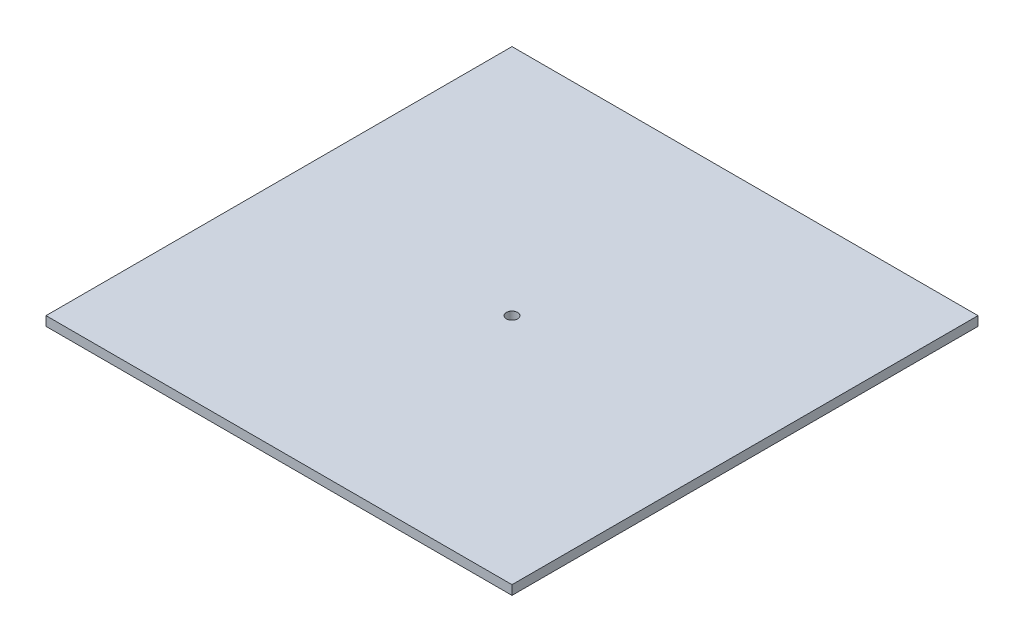
from build123d import *

# Parameters (mm, degrees)
ESQUISSE1_W                 = 500
ESQUISSE1_H                 = 500
BOSS_EXTRU_1_DEPTH          = 5
D_GAGEMENT_M101_D           = 12
D_GAGEMENT_M101_CSINK_D     = 12.05
D_GAGEMENT_M101_CSINK_ANGLE = 90


with BuildPart() as part:
    # Esquisse1 → Boss.-Extru.1 (new, symmetric)
    with BuildSketch(Plane(origin=(0, 0, 0), x_dir=(1, 0, 0), z_dir=(0, 1, 0))):
        Rectangle(ESQUISSE1_W, ESQUISSE1_H)
    extrude(amount=BOSS_EXTRU_1_DEPTH, both=True)

    # Dégagement M101 (through all)
    with Locations(Plane(origin=(0, 5, 0), x_dir=(1, 0, 0), z_dir=(0, 1, 0))):
        with Locations((0, 0)):
            CounterSinkHole(D_GAGEMENT_M101_D / 2, D_GAGEMENT_M101_CSINK_D / 2, counter_sink_angle=D_GAGEMENT_M101_CSINK_ANGLE)


solid = part.part
